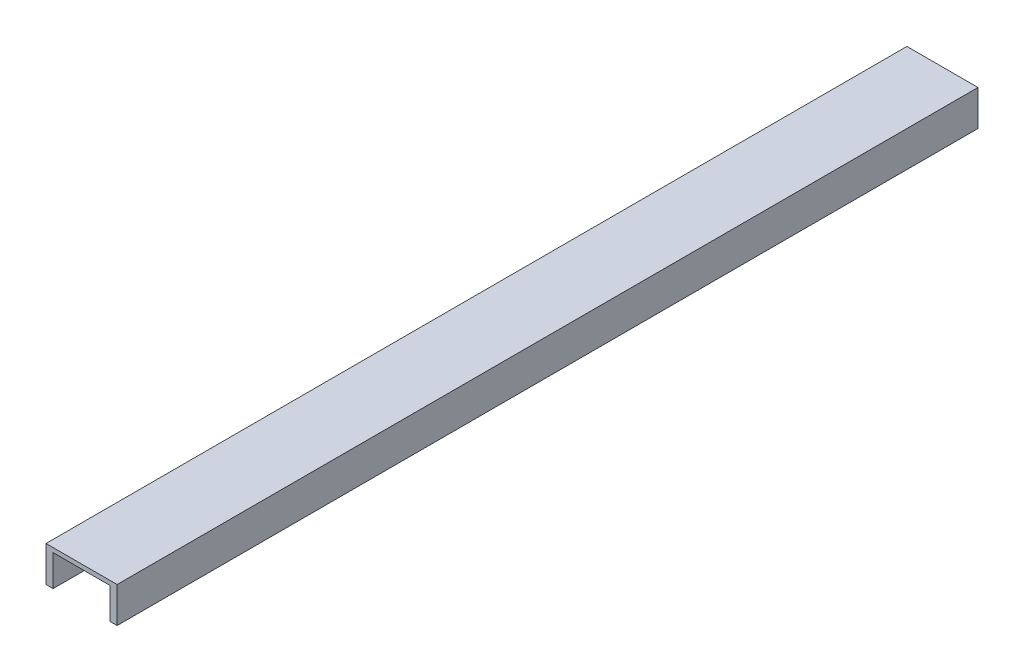
from build123d import *

# Parameters (mm, degrees)
SALIENTE_EXTRUIR1_DEPTH = 423.8


with BuildPart() as part:
    # Croquis1 → Saliente-Extruir1 (new, symmetric)
    with BuildSketch(Plane.XY):
        Polygon((-28, -17.5), (-28, 13.2), (28, 13.2), (28, -17.5), (35, -17.5), (35, 17.5), (-35, 17.5), (-35, -17.5), align=None)
    extrude(amount=SALIENTE_EXTRUIR1_DEPTH, both=True)


solid = part.part
